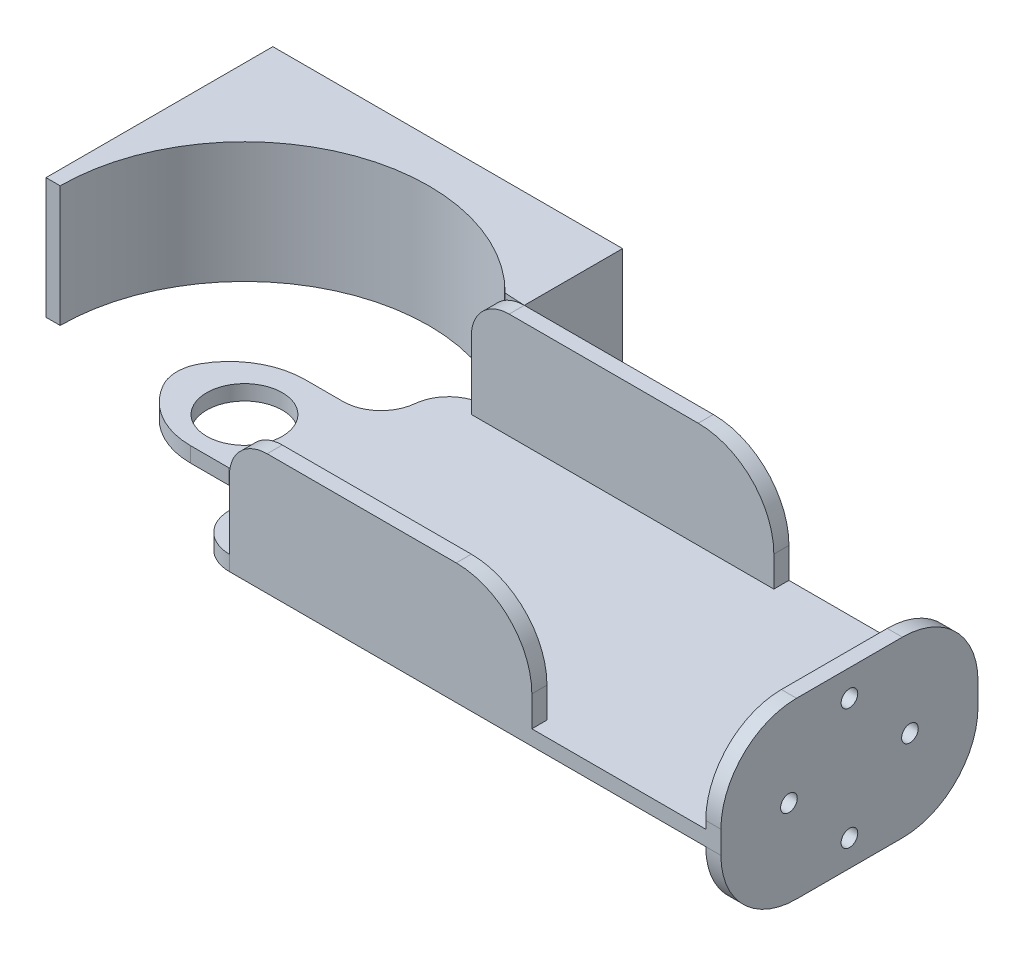
from build123d import *

# Parameters (mm, degrees)
ESQUISSE1_W             = 70
ESQUISSE1_H             = 34
ESQUISSE1_W_2           = 20
ESQUISSE1_H_2           = 15.140348997
ESQUISSE1_R             = 5
BOSS_EXTRU_1_DEPTH      = 2
CONG_1_R                = 10
CONG_3_R                = 5
CONG_4_R                = 5
CONG_5_R                = 5
ESQUISSE2_W             = 40
ESQUISSE2_H             = 2
BOSS_EXTRU_2_DEPTH      = 14
CONG_6_R                = 5
CONG_7_R                = 10
BOSS_EXTRU_3_DEPTH      = 16
ESQUISSE5_W             = 34
ESQUISSE5_H             = 11
ESQUISSE5_H_2           = 10
BOSS_EXTRU_4_DEPTH      = 2
ESQUISSE7_R             = 1.1
ENL_V_MAT_EXTRU_1_DEPTH = 2
CONG_8_R                = 10


with BuildPart() as part:
    # Esquisse1 → Boss.-Extru.1 (new body)
    # profile 1 of 2: a face of its own
    with BuildSketch(Plane(origin=(0, 0, 0), x_dir=(1, 0, 0), z_dir=(0, 1, 0))):
        with Locations((35, 17)):
            Rectangle(ESQUISSE1_W, ESQUISSE1_H)
    # profile 2 of 2: a face of its own
    with BuildSketch(Plane(origin=(0, 0, 0), x_dir=(1, 0, 0), z_dir=(0, 1, 0))):
        with Locations((-10, 17.429825501)):
            Rectangle(ESQUISSE1_W_2, ESQUISSE1_H_2)
        with Locations(Location((-10, 17, 0), (0, 0, 270))):
            Circle(ESQUISSE1_R, mode=Mode.SUBTRACT)
    extrude(amount=BOSS_EXTRU_1_DEPTH)

    # Congé1
    # the kernel refuses this fillet: 10 mm, written as the material it takes off along each edge
    with BuildSketch(Plane(origin=(-20, -25, -25), x_dir=(0, 0, 1), z_dir=(0, 1, 0)), Plane(origin=(-20, -25, -9.859651003), x_dir=(1, 0, 0), z_dir=(0, 1, 0))) as cong_1_piece_1:
        with BuildLine():
            CenterArc((CONG_1_R, CONG_1_R), CONG_1_R, 180, 90)
            Line((0, CONG_1_R), (0, 0))
            Line((0, 0), (CONG_1_R, 0))
        make_face()
    extrude(amount=52, mode=Mode.SUBTRACT)

    # Congé3
    cong_3_edges = [part.edges().sort_by_distance(p)[0] for p in [
        (-19.700306595, 1, -17.429825502),
    ]]
    fillet(cong_3_edges, radius=CONG_3_R)

    # Congé4
    cong_4_edges = [part.edges().sort_by_distance(p)[0] for p in [
        (0, 1, -34),
        (0, 1, 0),
    ]]
    fillet(cong_4_edges, radius=CONG_4_R)

    # Congé5
    cong_5_edges = [part.edges().sort_by_distance(p)[0] for p in [
        (0, 1, -25),
        (0, 1, -9.859651003),
    ]]
    fillet(cong_5_edges, radius=CONG_5_R)

    # Esquisse2 → Boss.-Extru.2 (add)
    with BuildSketch(Plane(origin=(0, 2, 0), x_dir=(1, 0, 0), z_dir=(0, 1, 0))):
        with Locations((25, 1)):
            Rectangle(ESQUISSE2_W, ESQUISSE2_H)
        with Locations((25, 33)):
            Rectangle(ESQUISSE2_W, ESQUISSE2_H)
    extrude(amount=BOSS_EXTRU_2_DEPTH)

    # Congé6
    cong_6_edges = [part.edges().sort_by_distance(p)[0] for p in [
        (5, 16, -33),
        (5, 16, -1),
    ]]
    fillet(cong_6_edges, radius=CONG_6_R)

    # Congé7
    cong_7_edges = [part.edges().sort_by_distance(p)[0] for p in [
        (45, 16, -33),
        (45, 16, -1),
    ]]
    fillet(cong_7_edges, radius=CONG_7_R)

    # Esquisse5 → Boss.-Extru.4 (add)
    with BuildSketch(Plane(origin=(70, 0, 0), x_dir=(0, 0, -1), z_dir=(1, 0, 0))):
        with Locations((17, 7.5)):
            Rectangle(ESQUISSE5_W, ESQUISSE5_H)
        with Locations((17, -5)):
            Rectangle(ESQUISSE5_W, ESQUISSE5_H_2)
    extrude(amount=-BOSS_EXTRU_4_DEPTH)

    # Esquisse7 → Enlèv. mat.-Extru.1 (cut)
    with BuildSketch(Plane(origin=(70, 0, 0), x_dir=(0, 0, -1), z_dir=(1, 0, 0))):
        with Locations((25, 1.5)):
            Circle(ESQUISSE7_R)
        with Locations((17, -6.5)):
            Circle(ESQUISSE7_R)
        with Locations((9, 1.5)):
            Circle(ESQUISSE7_R)
        with Locations((17, 9.5)):
            Circle(ESQUISSE7_R)
    extrude(amount=-ENL_V_MAT_EXTRU_1_DEPTH, mode=Mode.SUBTRACT)

    # Congé8
    cong_8_edges = [part.edges().sort_by_distance(p)[0] for p in [
        (69, -10, 0),
        (69, -10, -34),
        (69, 13, -34),
        (69, 13, 0),
    ]]
    fillet(cong_8_edges, radius=CONG_8_R)


with BuildPart() as body_2:
    # Esquisse4 → Boss.-Extru.3 (new body)
    with BuildSketch(Plane(origin=(0, 16, 0), x_dir=(1, 0, 0), z_dir=(0, 1, 0))):
        with BuildLine():
            ThreePointArc((10, 34), (-19.05604246, 41.637128383), (-36.248809497, 17))
            Line((-36.248809497, 17), (-36.248809497, 47))
            Line((-36.248809497, 47), (10, 47))
            Line((10, 47), (10, 34))
        make_face()
        with BuildLine():
            Line((-36.248809497, 17), (-34.374098883, 17))
            ThreePointArc((-34.374098883, 17), (-19.268300711, 39.543187403), (7.325518463, 34.144185788))
            Line((7.325518463, 34.144185788), (10, 34))
            ThreePointArc((10, 34), (-19.05604246, 41.637128383), (-36.248809497, 17))
        make_face()
    extrude(amount=-BOSS_EXTRU_3_DEPTH)


solid = Compound([part.part, body_2.part])
